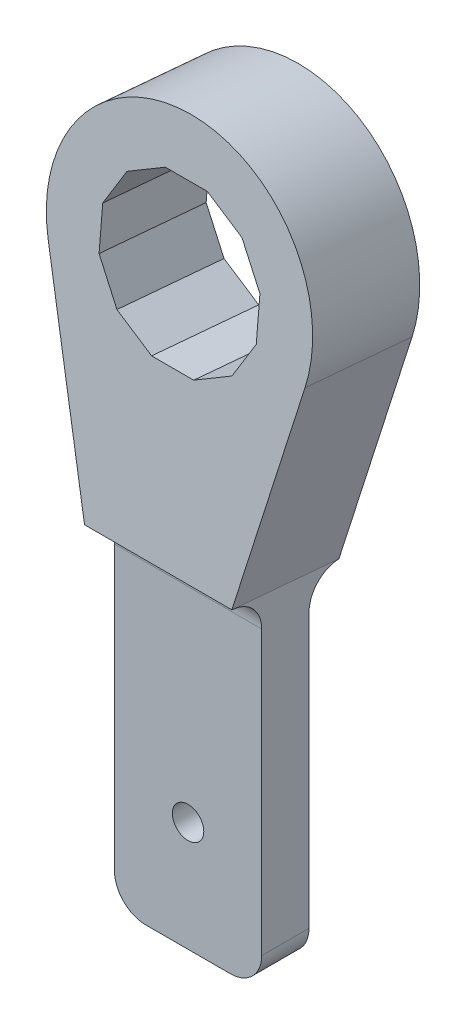
from build123d import *

# Parameters (mm, degrees)
BOSS_EXTRUDE1_DEPTH = 10.7188
SKETCH2_OUTSIDE_W   = 36.066
SKETCH2_OUTSIDE_H   = 73.696
CUT_EXTRUDE1_DEPTH  = 60.909415415
FILLET1_R           = 2.54
SKETCH6_R           = 1.27
CUT_EXTRUDE3_DEPTH  = 60.576572944
FILLET2_R           = 2.54


with BuildPart() as part:
    # Sketch1 → Boss-Extrude1 (new, symmetric)
    with BuildSketch(Plane(origin=(0, 0, 0), x_dir=(0, 0, -1), z_dir=(1, 0, 0))):
        Polygon((-4.567857039, -57.925462145), (-0.745157039, -57.925462145), (-0.745157039, -30.364014398), (1.670365013, -30.742566651), (4.326872052, -0.378552253), (-4.326872052, 0.378552253), (-6.983379091, -29.985462145), (-4.567857039, -30.364014398), align=None)
    extrude(amount=BOSS_EXTRUDE1_DEPTH, both=True)

    # Sketch2 outside → Cut-Extrude1 (cut, through all)
    # profile 1 of 2: a face of its own
    with BuildSketch(Plane(origin=(0, 0.378552253, 4.326872052), x_dir=(1, 0, 0), z_dir=(0, 0.08715574274765905, 0.9961946980917455))):
        with Locations((0, -28.78)):
            Rectangle(SKETCH2_OUTSIDE_W, SKETCH2_OUTSIDE_H)
        with BuildLine():
            Line((5.94995, -30.48), (10.375772253, -13.408785796))
            ThreePointArc((10.375772253, -13.408785796), (0, 0), (-10.375772253, -13.408785796))
            Line((-10.375772253, -13.408785796), (-5.94995, -30.48))
            Line((-5.94995, -30.48), (-5.94995, -58.103153246))
            Line((-5.94995, -58.103153246), (5.94995, -58.103153246))
            Line((5.94995, -58.103153246), (5.94995, -30.48))
        make_face(mode=Mode.SUBTRACT)
    # profile 2 of 2: a face of its own
    with BuildSketch(Plane(origin=(0, 0.378552253, 4.326872052), x_dir=(1, 0, 0), z_dir=(0, 0.08715574274765905, 0.9961946980917455))):
        Polygon((4.648522628, -6.070277372), (1.701477372, -4.3688), (-1.701477372, -4.3688), (-4.648522628, -6.070277372), (-6.35, -9.017322628), (-6.35, -12.420277372), (-4.648522628, -15.367322628), (-1.701477372, -17.0688), (1.701477372, -17.0688), (4.648522628, -15.367322628), (6.35, -12.420277372), (6.35, -9.017322628), align=None)
    extrude(amount=-CUT_EXTRUDE1_DEPTH, mode=Mode.SUBTRACT)

    # Fillet1
    # the kernel refuses this fillet: 2.54 mm, written as the material it adds along each edge
    with BuildSketch(Plane(origin=(-13.281888943, -30.364014398, 0.745157039), x_dir=(0, -0.15482679187338919, -0.9879416301169793), z_dir=(1, 0, 0))) as fillet1_piece_1_section:
        with BuildLine():
            CenterArc((2.960769294, -2.487084038), FILLET1_R, 101.715774122, 87.190976769)
            Line((0.451397554, -2.880344089), (0.401210119, -2.88820929))
            Line((0.401210119, -2.88820929), (-0.050187435, -0.007865201))
            Line((-0.050187435, -0.007865201), (0, 0.0508))
            ThreePointArc((0, 0.0508), (1.222502412, 0.0508), (2.434689535, 0.049741681))
            Line((2.434689535, 0.049741681), (2.445004824, 0))
        make_face()
    fillet1_piece_1 = extrude(amount=26.563777885, mode=Mode.PRIVATE)
    fillet1_piece_1 = split(fillet1_piece_1, bisect_by=Plane(origin=(-5.94995, -31.737023375, 0.445932994), z_dir=(1, 0, 0)), keep=Keep.TOP, mode=Mode.PRIVATE)
    fillet1_piece_1 = split(fillet1_piece_1, bisect_by=Plane(origin=(-5.654886332, -31.700159235, 0.4427078), z_dir=(-0.9679975606806361, -0.2500046262979335, 0.021872570630104494)), keep=Keep.TOP, mode=Mode.PRIVATE)
    add(fillet1_piece_1)
    with BuildSketch(Plane(origin=(-13.281888943, -30.364014398, 0.745157039), x_dir=(0, -0.15482679187338919, -0.9879416301169793), z_dir=(1, 0, 0))) as fillet1_piece_2_section:
        with BuildLine():
            CenterArc((2.960769294, -2.487084038), FILLET1_R, 101.715774122, 87.190976769)
            Line((0.451397554, -2.880344089), (0.401210119, -2.88820929))
            Line((0.401210119, -2.88820929), (-0.050187435, -0.007865201))
            Line((-0.050187435, -0.007865201), (0, 0.0508))
            ThreePointArc((0, 0.0508), (1.222502412, 0.0508), (2.434689535, 0.049741681))
            Line((2.434689535, 0.049741681), (2.445004824, 0))
        make_face()
    fillet1_piece_2 = extrude(amount=26.563777885, mode=Mode.PRIVATE)
    fillet1_piece_2 = split(fillet1_piece_2, bisect_by=Plane(origin=(-5.94995, -31.133883126, 0.125173685), z_dir=(1, 0, 0)), keep=Keep.TOP, mode=Mode.PRIVATE)
    fillet1_piece_2 = split(fillet1_piece_2, bisect_by=Plane(origin=(5.442501536, -32.539517415, 0.248150751), z_dir=(-0.967997560680636, 0.2500046262979333, -0.021872570630104476)), keep=Keep.TOP, mode=Mode.PRIVATE)
    fillet1_piece_2 = split(fillet1_piece_2, bisect_by=Plane(origin=(-5.442501536, -32.539517415, 0.248150751), z_dir=(0.9679975606806361, 0.2500046262979335, -0.021872570630104494)), keep=Keep.TOP, mode=Mode.PRIVATE)
    fillet1_piece_2 = split(fillet1_piece_2, bisect_by=Plane(origin=(5.94995, -31.133883126, 0.125173685), z_dir=(-1, 0, 0)), keep=Keep.TOP, mode=Mode.PRIVATE)
    add(fillet1_piece_2)
    with BuildSketch(Plane(origin=(-13.281888943, -30.364014398, 0.745157039), x_dir=(0, -0.15482679187338919, -0.9879416301169793), z_dir=(1, 0, 0))) as fillet1_piece_3_section:
        with BuildLine():
            CenterArc((2.960769294, -2.487084038), FILLET1_R, 101.715774122, 87.190976769)
            Line((0.451397554, -2.880344089), (0.401210119, -2.88820929))
            Line((0.401210119, -2.88820929), (-0.050187435, -0.007865201))
            Line((-0.050187435, -0.007865201), (0, 0.0508))
            ThreePointArc((0, 0.0508), (1.222502412, 0.0508), (2.434689535, 0.049741681))
            Line((2.434689535, 0.049741681), (2.445004824, 0))
        make_face()
    fillet1_piece_3 = extrude(amount=26.563777885, mode=Mode.PRIVATE)
    fillet1_piece_3 = split(fillet1_piece_3, bisect_by=Plane(origin=(-5.94995, -30.484623478, 0.0088191), z_dir=(-1, 0, 0)), keep=Keep.TOP, mode=Mode.PRIVATE)
    fillet1_piece_3 = split(fillet1_piece_3, bisect_by=Plane(origin=(-5.977723598, -30.488093407, 0.009122679), z_dir=(0.9679975606806361, 0.2500046262979335, -0.021872570630104494)), keep=Keep.TOP, mode=Mode.PRIVATE)
    add(fillet1_piece_3)
    with BuildSketch(Plane(origin=(-13.281888943, -30.364014398, 0.745157039), x_dir=(0, -0.15482679187338919, -0.9879416301169793), z_dir=(1, 0, 0))) as fillet1_piece_4_section:
        with BuildLine():
            CenterArc((2.960769294, -2.487084038), FILLET1_R, 101.715774122, 87.190976769)
            Line((0.451397554, -2.880344089), (0.401210119, -2.88820929))
            Line((0.401210119, -2.88820929), (-0.050187435, -0.007865201))
            Line((-0.050187435, -0.007865201), (0, 0.0508))
            ThreePointArc((0, 0.0508), (1.222502412, 0.0508), (2.434689535, 0.049741681))
            Line((2.434689535, 0.049741681), (2.445004824, 0))
        make_face()
    fillet1_piece_4 = extrude(amount=26.563777885, mode=Mode.PRIVATE)
    fillet1_piece_4 = split(fillet1_piece_4, bisect_by=Plane(origin=(5.654886332, -31.700159235, 0.4427078), z_dir=(0.967997560680636, -0.2500046262979333, 0.021872570630104476)), keep=Keep.TOP, mode=Mode.PRIVATE)
    fillet1_piece_4 = split(fillet1_piece_4, bisect_by=Plane(origin=(5.94995, -31.737023375, 0.445932994), z_dir=(-1, 0, 0)), keep=Keep.TOP, mode=Mode.PRIVATE)
    add(fillet1_piece_4)
    with BuildSketch(Plane(origin=(-13.281888943, -30.364014398, 0.745157039), x_dir=(0, -0.15482679187338919, -0.9879416301169793), z_dir=(1, 0, 0))) as fillet1_piece_5_section:
        with BuildLine():
            CenterArc((2.960769294, -2.487084038), FILLET1_R, 101.715774122, 87.190976769)
            Line((0.451397554, -2.880344089), (0.401210119, -2.88820929))
            Line((0.401210119, -2.88820929), (-0.050187435, -0.007865201))
            Line((-0.050187435, -0.007865201), (0, 0.0508))
            ThreePointArc((0, 0.0508), (1.222502412, 0.0508), (2.434689535, 0.049741681))
            Line((2.434689535, 0.049741681), (2.445004824, 0))
        make_face()
    fillet1_piece_5 = extrude(amount=26.563777885, mode=Mode.PRIVATE)
    fillet1_piece_5 = split(fillet1_piece_5, bisect_by=Plane(origin=(5.977723598, -30.488093407, 0.009122679), z_dir=(-0.967997560680636, 0.2500046262979333, -0.021872570630104476)), keep=Keep.TOP, mode=Mode.PRIVATE)
    fillet1_piece_5 = split(fillet1_piece_5, bisect_by=Plane(origin=(5.94995, -30.484623478, 0.0088191), z_dir=(1, 0, 0)), keep=Keep.TOP, mode=Mode.PRIVATE)
    add(fillet1_piece_5)
    with BuildSketch(Plane(origin=(5.94995, -30.364014398, 4.567857039), x_dir=(0, 0.15482679187338733, 0.9879416301169794), z_dir=(-1, 0, 0))) as fillet1_piece_6:
        with BuildLine():
            CenterArc((FILLET1_R * 0.855489011053, -FILLET1_R), FILLET1_R, 90, 81.093249109)
            Line((-FILLET1_R * 0.132452619064, -FILLET1_R * 0.845173208127), (-FILLET1_R * 0.152211451667, -FILLET1_R * 0.842076672289))
            Line((-FILLET1_R * 0.152211451667, -FILLET1_R * 0.842076672289), (-FILLET1_R * 0.0171097802211, FILLET1_R * 0.02))
            Line((-FILLET1_R * 0.0171097802211, FILLET1_R * 0.02), (FILLET1_R * 0.855489011053, FILLET1_R * 0.02))
            Line((FILLET1_R * 0.855489011053, FILLET1_R * 0.02), (FILLET1_R * 0.855489011053, 0))
        make_face()
    extrude(amount=11.8999)

    # Sketch6 → Cut-Extrude3 (cut, through all)
    with BuildSketch(Plane.XY.offset(4.567857039)):
        with Locations((0, -49.046956486)):
            Circle(SKETCH6_R)
    extrude(amount=-CUT_EXTRUDE3_DEPTH, mode=Mode.SUBTRACT)

    # Fillet2
    fillet2_edges = [part.edges().sort_by_distance(p)[0] for p in [
        (5.94995, -57.925462145, 2.656507039),
        (-5.94995, -57.925462145, 2.656507039),
    ]]
    fillet(fillet2_edges, radius=FILLET2_R)


solid = part.part
